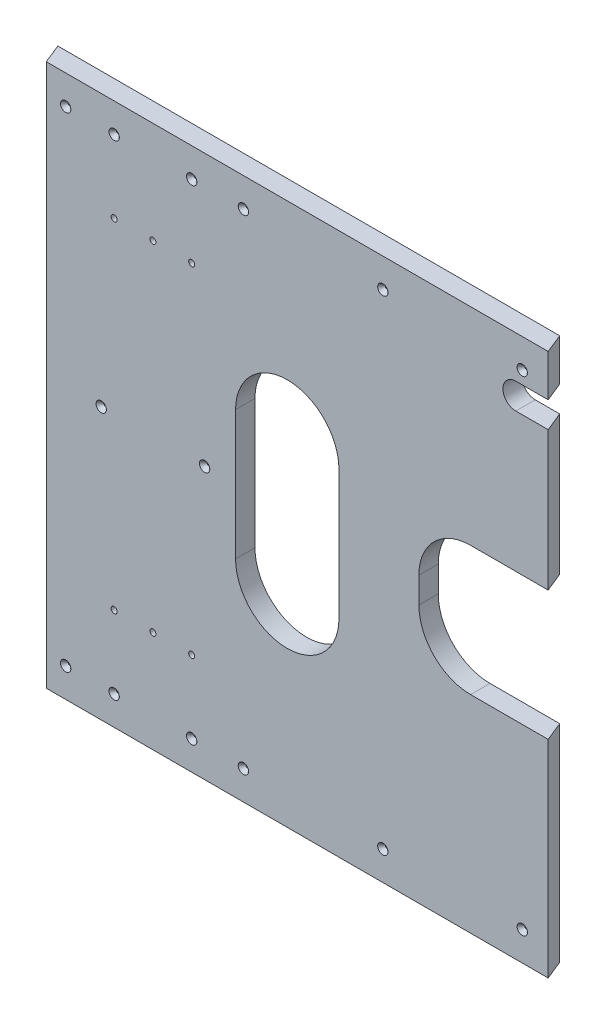
from build123d import *

# Parameters (mm, degrees)
SKETCH1_W                        = 493.106084352
SKETCH1_H                        = 533.146
BOSS_EXTRUDE1_DEPTH              = 19.05
BOSS_EXTRUDE3_DEPTH              = 533.146
CUT_EXTRUDE1_DEPTH               = 5496.210802379
SKETCH5_W                        = 127
SKETCH5_H                        = 127
CUT_EXTRUDE2_DEPTH               = 5496.210802379
FILLET1_R                        = 50.8
CUT_EXTRUDE3_DEPTH               = 5496.210802379
F_15_64_0_23438_DIAMETER_HOLE1_D = 5.953252
CUT_EXTRUDE4_DEPTH               = 5496.210802379
HOLE1_D                          = 3.175
HOLE1_DEPTH                      = 50.8
HOLE1_CSINK_D                    = 10.16
HOLE1_CSINK_ANGLE                = 82
HOLE1_TIP                        = 0.953866233


with BuildPart() as part:
    # Sketch1 → Boss-Extrude1 (new body)
    with BuildSketch(Plane.XY):
        with Locations((-5222.700490325, 266.573)):
            Rectangle(SKETCH1_W, SKETCH1_H)
    extrude(amount=BOSS_EXTRUDE1_DEPTH)

    # Boss-Extrude3: read off the stored shape, not the designer's step
    # Boss-Extrude3 outline → Boss-Extrude3 (add)
    with BuildSketch(Plane(origin=(0, 0, 0), x_dir=(1, 0, 0), z_dir=(0, 1, 0))):
        Polygon((-4976.147448149, -19.05), (-4968.450748546, -19.05), (-4976.147448148, 0), align=None)
    extrude(amount=BOSS_EXTRUDE3_DEPTH)

    # Sketch2 → Cut-Extrude1 (cut, through all)
    with BuildSketch(Plane(origin=(0, 533.146, 0), x_dir=(1, 0, 0), z_dir=(0, 1, 0))):
        Polygon((-5469.253532501, 0), (-5461.556832899, -19.05), (-5469.253532501, -19.05), align=None)
    extrude(amount=-CUT_EXTRUDE1_DEPTH, mode=Mode.SUBTRACT)

    # Sketch5 → Cut-Extrude2 (cut, through all)
    with BuildSketch(Plane.XY.offset(19.05)):
        with Locations((-5031.950748546, 266.573)):
            Rectangle(SKETCH5_W, SKETCH5_H)
    extrude(amount=-CUT_EXTRUDE2_DEPTH, mode=Mode.SUBTRACT)

    # Fillet1
    fillet1_edges = [part.edges().sort_by_distance(p)[0] for p in [
        (-5095.450748546, 330.073, 9.525),
        (-5095.450748546, 203.073, 9.525),
    ]]
    fillet(fillet1_edges, radius=FILLET1_R)

    # Sketch6 → Cut-Extrude3 (cut, through all)
    with BuildSketch(Plane.XY.offset(19.05)):
        with BuildLine():
            Line((-5275.586530946, 203.073), (-5275.586530946, 330.073))
            ThreePointArc((-5275.586530946, 330.073), (-5224.786530946, 380.873), (-5173.986530946, 330.073))
            Line((-5173.986530946, 330.073), (-5173.986530946, 203.073))
            ThreePointArc((-5173.986530946, 203.073), (-5224.786530946, 152.273), (-5275.586530946, 203.073))
        make_face()
    extrude(amount=-CUT_EXTRUDE3_DEPTH, mode=Mode.SUBTRACT)

    # 15/64 (0.23438) Diameter Hole1 (through all)
    with Locations(Plane.XY.offset(19.05)):
        with Locations((-5394.881832899, 99.8855), (-5356.781832899, 99.8855), (-5318.681832899, 99.8855), (-5318.681832899, 433.2605), (-5356.781832899, 433.2605), (-5394.881832899, 433.2605)):
            Hole(F_15_64_0_23438_DIAMETER_HOLE1_D / 2)

    # Sketch9 → Cut-Extrude4 (cut, through all)
    with BuildSketch(Plane.XY.offset(19.05)):
        with BuildLine():
            Line((-4936.700748546, 466.598), (-5000.200748546, 466.598))
            ThreePointArc((-5000.200748546, 466.598), (-5012.900748546, 479.298), (-5000.200748546, 491.998))
            Line((-5000.200748546, 491.998), (-4936.700748546, 491.998))
            ThreePointArc((-4936.700748546, 491.998), (-4924.000748546, 479.298), (-4936.700748546, 466.598))
        make_face()
    extrude(amount=-CUT_EXTRUDE4_DEPTH, mode=Mode.SUBTRACT)

    # Hole1
    with Locations(Plane(origin=(1.791e-06, 266.573, 19.05), x_dir=(0, 1, 0), z_dir=(0, 0, 1))):
        with Locations((237.998, 5442.50683469), (-237.998, 5442.50683469), (-237.998, 5394.88183469), (-237.998, 5318.68183469), (0, 5407.58183469), (0, 5305.98183469), (-237.998, 5267.88183469), (-237.998, 5130.866292514), (-237.998, 4993.850750338), (237.998, 4993.850750338), (237.998, 5130.866292514), (237.998, 5267.88183469), (237.998, 5318.68183469), (237.998, 5394.88183469)):
            CounterSinkHole(HOLE1_D / 2, HOLE1_CSINK_D / 2, depth=HOLE1_DEPTH, counter_sink_angle=HOLE1_CSINK_ANGLE)
            with Locations((0, 0, -(HOLE1_DEPTH + HOLE1_TIP / 2))):  # 118° drill point
                Cone(0, HOLE1_D / 2, HOLE1_TIP, mode=Mode.SUBTRACT)


solid = part.part
